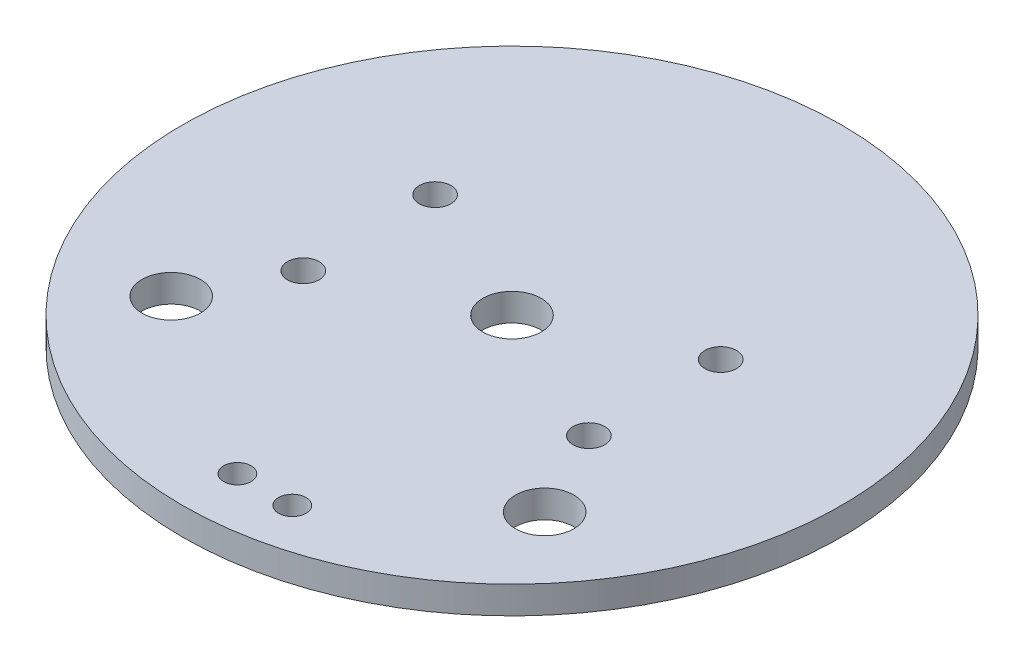
from build123d import *

# Parameters (mm, degrees)
SKETCH1_R                    = 38.1
BOSS_EXTRUDE1_DEPTH          = 1.5875
F_1_4_CLEARANCE_HOLE1_D      = 6.7564
F_1_4_CLEARANCE_HOLE2_D      = 6.7564
F_1_8_0_125_DIAMETER_HOLE1_D = 3.175
F_27_0_144_DIAMETER_HOLE1_D  = 3.6576


with BuildPart() as part:
    # Sketch1 → Boss-Extrude1 (new, symmetric)
    with BuildSketch(Plane(origin=(0, 0, 0), x_dir=(1, 0, 0), z_dir=(0, 1, 0))):
        Circle(SKETCH1_R)
    extrude(amount=BOSS_EXTRUDE1_DEPTH, both=True)

    # 1/4 Clearance Hole1 (through all)
    with Locations(Plane(origin=(0, 1.5875, 0), x_dir=(1, 0, 0), z_dir=(0, 1, 0))):
        with Locations((-21.59, -17.810706314), (21.59, -17.810706314)):
            Hole(F_1_4_CLEARANCE_HOLE1_D / 2)

    # 1/4 Clearance Hole2 (through all)
    with Locations(Plane(origin=(0, 1.5875, 0), x_dir=(1, 0, 0), z_dir=(0, 1, 0))):
        with Locations((0, 0)):
            Hole(F_1_4_CLEARANCE_HOLE2_D / 2)

    # 1/8 (0.125) Diameter Hole1 (through all)
    with Locations(Plane(origin=(0, 1.5875, 0), x_dir=(1, 0, 0), z_dir=(0, 1, 0))):
        with Locations((0, -31.75), (6.35, -31.75)):
            Hole(F_1_8_0_125_DIAMETER_HOLE1_D / 2)

    # #27 (0.144) Diameter Hole1 (through all)
    with Locations(Plane(origin=(0, 1.5875, 0), x_dir=(1, 0, 0), z_dir=(0, 1, 0))):
        with Locations((-16.51, 7.62), (16.51, 7.62), (16.51, -7.62), (-16.51, -7.62)):
            Hole(F_27_0_144_DIAMETER_HOLE1_D / 2)


solid = part.part
